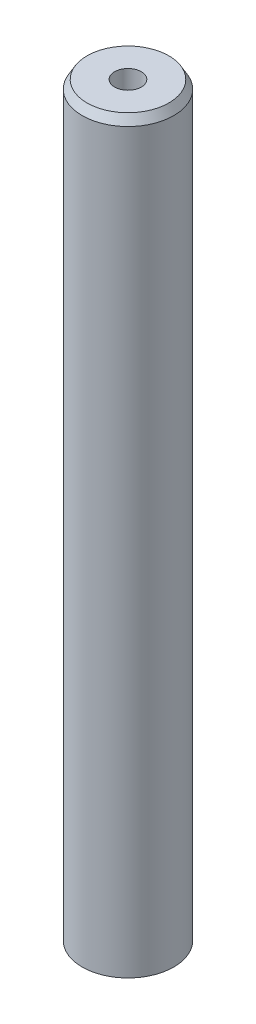
from build123d import *
from OCP.BRepFilletAPI import BRepFilletAPI_MakeChamfer

# Parameters (mm, degrees)
SKETCH1_R           = 12.5
BOSS_EXTRUDE1_DEPTH = 204.938461608
SKETCH2_R           = 3.639732374
CUT_EXTRUDE1_DEPTH  = 206.699472645
CHAMFER1_SIZE       = 2.320535296
CHAMFER1_SIZE2      = 1.339761678


with BuildPart() as part:
    # Sketch1 → Boss-Extrude1 (new body)
    with BuildSketch(Plane(origin=(0, 0, 0), x_dir=(1, 0, 0), z_dir=(0, 1, 0))):
        Circle(SKETCH1_R)
    extrude(amount=BOSS_EXTRUDE1_DEPTH)

    # Sketch2 → Cut-Extrude1 (cut, through all)
    with BuildSketch(Plane(origin=(0, 0, 0), x_dir=(1, 0, 0), z_dir=(0, 1, 0))):
        Circle(SKETCH2_R)
    extrude(amount=CUT_EXTRUDE1_DEPTH, mode=Mode.SUBTRACT)

    # Chamfer1: one chamfer whose edges measure the first distance from different faces: ONE call of the kernel's chamfer builder (chamfer() names one face for all edges)
    chamfer1_edges_1 = [part.edges().sort_by_distance(p)[0] for p in [
        (-12.5, 204.938461608, 0),
    ]]
    chamfer1_side_1 = [part.faces().sort_by_distance(p)[0] for p in [
        (-12.5, 102.469230804, 0),
    ]]
    chamfer1_edges_2 = [part.edges().sort_by_distance(p)[0] for p in [
        (-12.5, 0, 0),
    ]]
    chamfer1_side_2 = [part.faces().sort_by_distance(p)[0] for p in [
        (-12.146446609, 0, 0),
    ]]
    chamfer1 = BRepFilletAPI_MakeChamfer(part.part.solid().wrapped)
    for e in chamfer1_edges_1:
        chamfer1.Add(CHAMFER1_SIZE, CHAMFER1_SIZE2, e.wrapped, chamfer1_side_1[0].wrapped)  # the first distance lies on this face
    for e in chamfer1_edges_2:
        chamfer1.Add(CHAMFER1_SIZE, CHAMFER1_SIZE2, e.wrapped, chamfer1_side_2[0].wrapped)  # the first distance lies on this face
    add(Compound.cast(chamfer1.Shape()), mode=Mode.REPLACE)


solid = part.part
